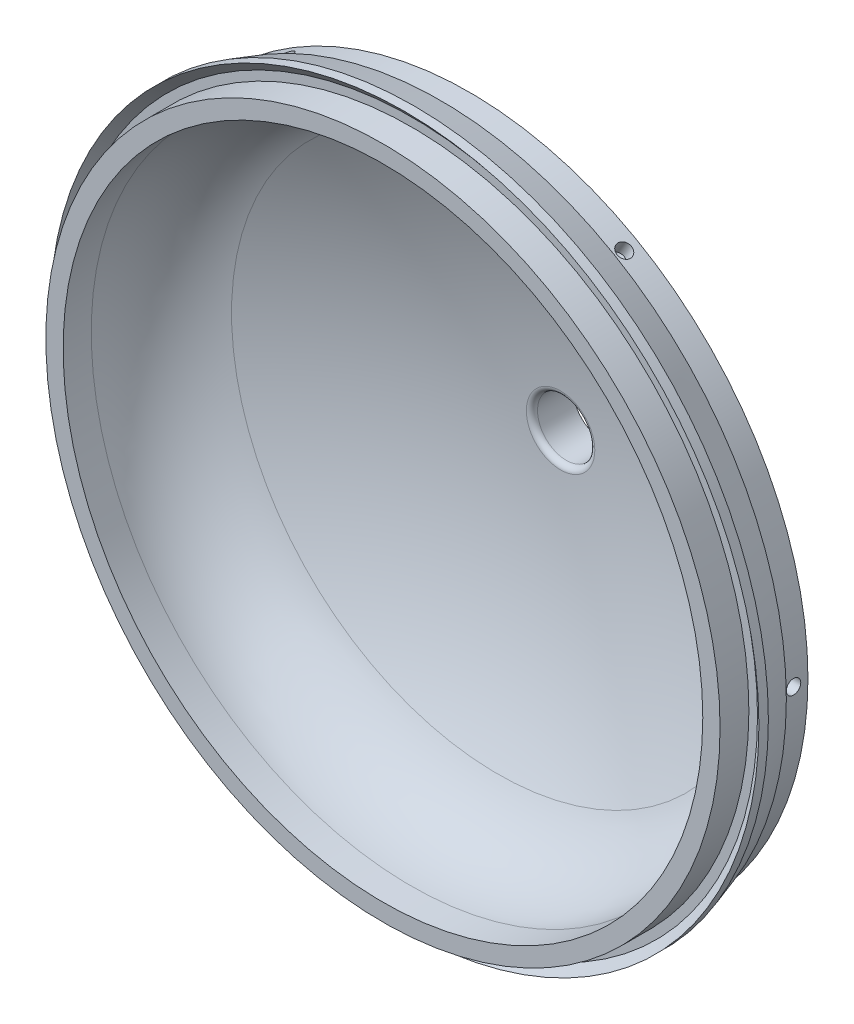
from build123d import *

# Parameters (mm, degrees)
BOSS_EXTRUDE2_REACH      = 243.079
BOSS_EXTRUDE2_END_RADIUS = 266.319
SKETCH10_R               = 25.4
SKETCH11_R               = 12.7
CUT_EXTRUDE1_DEPTH       = 190.754
CIRPATTERN1_COUNT        = 6


with BuildPart() as part:
    # Sketch1 → Revolve1 (revolve)
    with BuildSketch(Plane(origin=(0, 0, 0), x_dir=(1, 0, 0), z_dir=(0, 1, 0)), mode=Mode.PRIVATE) as revolve1_sk:
        with BuildLine():
            Line((-148.59, 0), (-140.97, 0))
            Line((-140.97, 0), (-140.97, 12.391039743))
            ThreePointArc((-140.97, 12.391039743), (-134.615921102, 34.866271953), (-117.434796957, 50.687755913))
            ThreePointArc((-117.434796957, 50.687755913), (-60.367509579, 71.617582047), (0, 78.72368491))
            Line((0, 78.72368491), (0, 85.07368491))
            ThreePointArc((0, 85.07368491), (-61.842045719, 77.794008454), (-120.303258046, 56.352950612))
            ThreePointArc((-120.303258046, 56.352950612), (-131.462846302, 48.602983737), (-140.081763243, 38.1))
            Line((-140.081763243, 38.1), (-149.225, 38.1))
            Line((-149.225, 38.1), (-149.225, 25.4))
            Line((-149.225, 25.4), (-152.4, 25.4))
            Line((-152.4, 25.4), (-156.21, 13.674025723))
            Line((-156.21, 13.674025723), (-156.21, 9.503030405))
            Line((-156.21, 9.503030405), (-152.4, 12.7))
            Line((-152.4, 12.7), (-148.59, 12.7))
            Line((-148.59, 12.7), (-148.59, 0))
        make_face()
    revolve(revolve1_sk.sketch.rotate(Axis((0, 0, -78.72368491), (0, 0, -1)), 180), axis=Axis((0, 0, -78.72368491), (0, 0, -1)))

    # Boss-Extrude2: up to this sphere (the profile starts outside it)
    boss_extrude2_end = Location((0, 0, 181.24531509)) * Sphere(BOSS_EXTRUDE2_END_RADIUS, mode=Mode.PRIVATE)
    # Sketch10 → Boss-Extrude2 (add, up to the surface)
    with BuildSketch(Plane.XY.offset(-96.52), mode=Mode.PRIVATE) as boss_extrude2_sk1:
        Circle(SKETCH10_R)
    boss_extrude2_tool1 = extrude(boss_extrude2_sk1.sketch, amount=BOSS_EXTRUDE2_REACH, mode=Mode.PRIVATE) - boss_extrude2_end
    add(boss_extrude2_tool1.solids().sort_by_distance((0, 0, -96.52))[0])

    # Sketch11 → Cut-Extrude1 (cut)
    with BuildSketch(Plane.XY):
        Circle(SKETCH11_R)
    extrude(amount=-CUT_EXTRUDE1_DEPTH, mode=Mode.SUBTRACT)

    # Sketch15 → 1/4 (0.25) Diameter Hole1 (revolve, cut)
    with BuildSketch(Plane(origin=(149.225, 0, -31.75), x_dir=(0, 0, -1), z_dir=(0, 1, 0))):
        Polygon((0, 0), (0, 8.257732465), (3.175, 6.35), (3.175, 0), align=None)
    f_1_4_0_25_diameter_hole1 = revolve(axis=Axis((155.575, 0, -31.75), (-1, 0, 0)), mode=Mode.SUBTRACT)

    # CirPattern1: 1/4 (0.25) Diameter Hole1 ×6 about axis
    cirpattern1_axis = Axis((0, 0, 5.473137056), (0, 0, -1))
    for i in range(1, CIRPATTERN1_COUNT):
        add(f_1_4_0_25_diameter_hole1.rotate(cirpattern1_axis, i * 360 / CIRPATTERN1_COUNT), mode=Mode.SUBTRACT)

    # Fillet1: read off the stored shape, not the designer's step
    # Fillet1 outline → Fillet1 (revolve, cut)
    with BuildSketch(Plane.XZ):
        with BuildLine():
            ThreePointArc((12.7, -80.82093127), (13.39254924, -79.077794531), (15.092539913, -78.285215291))
            Line((15.092539913, -78.285215291), (12.7, -78.285215291))
            Line((12.7, -78.285215291), (12.7, -80.82093127))
        make_face()
    revolve(axis=Axis((0, 0, 0), (0, 0, 1)), mode=Mode.SUBTRACT)


solid = part.part
